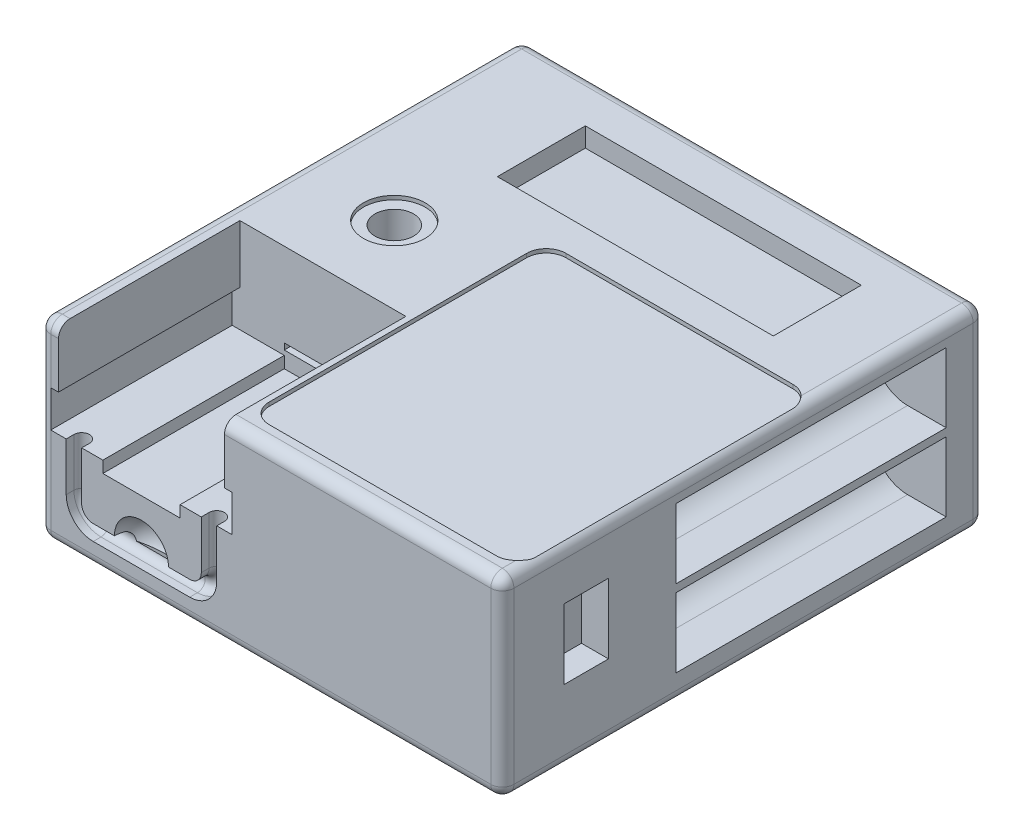
from build123d import *

# Parameters (mm, degrees)
SKETCH1_W           = 120
SKETCH1_H           = 125
BOSS_EXTRUDE1_DEPTH = 70
SKETCH3_W           = 47
SKETCH3_H           = 9.5
CUT_EXTRUDE1_DEPTH  = 47
SKETCH4_W           = 43
SKETCH4_H           = 15
CUT_EXTRUDE2_DEPTH  = 47
CUT_REVOLVE1_ANGLE  = 120
SKETCH9_W           = 20
SKETCH9_H           = 47
CUT_EXTRUDE3_DEPTH  = 3
SKETCH10_W          = 20
SKETCH10_H          = 1.6
CUT_EXTRUDE4_DEPTH  = 3.5
CUT_EXTRUDE5_DEPTH  = 1
SKETCH13_W          = 71.5
SKETCH13_H          = 22.8
CUT_EXTRUDE6_DEPTH  = 5
SKETCH14_R          = 5
CUT_EXTRUDE7_DEPTH  = 10
SKETCH15_R          = 8
CUT_EXTRUDE8_DEPTH  = 1
SKETCH16_W          = 70
SKETCH16_H          = 18
CUT_EXTRUDE9_DEPTH  = 10
SKETCH17_W          = 70
SKETCH17_H          = 9
SKETCH18_W          = 70
SKETCH18_H          = 9
SKETCH19_W          = 60
SKETCH19_H          = 15
CUT_EXTRUDE10_DEPTH = 60
CUT_REVOLVE4_ANGLE  = 90
SKETCH21_W          = 120
SKETCH21_H          = 125
CUT_EXTRUDE11_DEPTH = 20
FILLET1_R           = 3
FILLET2_R           = 3
SKETCH22_W          = 11.5
SKETCH22_H          = 18.1
CUT_EXTRUDE12_DEPTH = 7


# Some blends are built 0.0001 mm under size
with BuildPart() as part:
    # Sketch1 → Boss-Extrude1 (new body)
    with BuildSketch(Plane(origin=(0, 0, 0), x_dir=(1, 0, 0), z_dir=(0, 1, 0))):
        with Locations((60, 62.5)):
            Rectangle(SKETCH1_W, SKETCH1_H)
    extrude(amount=BOSS_EXTRUDE1_DEPTH)

    # Sketch3 → Cut-Extrude1 (cut)
    with BuildSketch(Plane.XY):
        with Locations((26.5, 50.25)):
            Rectangle(SKETCH3_W, SKETCH3_H)
    extrude(amount=-CUT_EXTRUDE1_DEPTH, mode=Mode.SUBTRACT)

    # Sketch4 → Cut-Extrude2 (cut)
    with BuildSketch(Plane.XY):
        with Locations((26.5, 62.5)):
            Rectangle(SKETCH4_W, SKETCH4_H)
    extrude(amount=-CUT_EXTRUDE2_DEPTH, mode=Mode.SUBTRACT)

    # Cut-Sweep1: sweep along a path in Sketch5
    with BuildLine(Plane.XY) as cut_sweep1_path:
        Line((9, 45.5), (9, 33))
        ThreePointArc((9, 33), (10.464466094, 29.464466094), (14, 28))
        Line((14, 28), (39, 28))
        ThreePointArc((39, 28), (42.535533906, 29.464466094), (44, 33))
        Line((44, 33), (44, 45.5))
    # Sketch6 → Cut-Sweep1 (sweep, cut)
    with BuildSketch(Plane(origin=(0, 45.5, 0), x_dir=(1, 0, 0), z_dir=(0, 1, 0))):
        with BuildLine():
            Line((7, 0), (7, 2))
            ThreePointArc((7, 2), (9, 4), (11, 2))
            Line((11, 2), (11, 0))
            Line((11, 0), (7, 0))
        make_face()
    sweep(path=cut_sweep1_path.line, mode=Mode.SUBTRACT)

    # Sketch7 → Cut-Revolve1 (revolve, cut)
    with BuildSketch(Plane.XY):
        with BuildLine():
            Line((19.5, 30), (33.5, 30))
            ThreePointArc((33.5, 30), (26.5, 37), (19.5, 30))
        make_face()
    revolve(axis=Axis((19.5, 30, 0), (-1, 0, 0)), revolution_arc=CUT_REVOLVE1_ANGLE, mode=Mode.SUBTRACT)

    # Sketch9 → Cut-Extrude3 (cut)
    with BuildSketch(Plane(origin=(0, 45.5, 0), x_dir=(1, 0, 0), z_dir=(0, 1, 0))):
        with Locations((26.5, 23.5)):
            Rectangle(SKETCH9_W, SKETCH9_H)
    extrude(amount=-CUT_EXTRUDE3_DEPTH, mode=Mode.SUBTRACT)

    # Sketch10 → Cut-Extrude4 (cut)
    with BuildSketch(Plane.XY.offset(-47)):
        with Locations((26.5, 47.5)):
            Rectangle(SKETCH10_W, SKETCH10_H)
    extrude(amount=-CUT_EXTRUDE4_DEPTH, mode=Mode.SUBTRACT)

    # Sketch11 → Cut-Extrude5 (cut)
    with BuildSketch(Plane(origin=(0, 70, 0), x_dir=(1, 0, 0), z_dir=(0, 1, 0))):
        with BuildLine():
            Line((54.58, 81.89), (113.38, 81.89))
            ThreePointArc((113.38, 81.89), (116.972102448, 80.402102448), (118.46, 76.81))
            Line((118.46, 76.81), (118.46, 10.08))
            ThreePointArc((118.46, 10.08), (116.972102448, 6.487897552), (113.38, 5))
            Line((113.38, 5), (54.58, 5))
            ThreePointArc((54.58, 5), (50.987897552, 6.487897552), (49.5, 10.08))
            Line((49.5, 10.08), (49.5, 76.81))
            ThreePointArc((49.5, 76.81), (50.987897552, 80.402102448), (54.58, 81.89))
        make_face()
    extrude(amount=-CUT_EXTRUDE5_DEPTH, mode=Mode.SUBTRACT)

    # Sketch13 → Cut-Extrude6 (cut)
    with BuildSketch(Plane(origin=(0, 70, 0), x_dir=(1, 0, 0), z_dir=(0, 1, 0))):
        with Locations((64.25, 101.6)):
            Rectangle(SKETCH13_W, SKETCH13_H)
    extrude(amount=-CUT_EXTRUDE6_DEPTH, mode=Mode.SUBTRACT)

    # Sketch14 → Cut-Extrude7 (cut)
    with BuildSketch(Plane(origin=(0, 70, 0), x_dir=(1, 0, 0), z_dir=(0, 1, 0))):
        with Locations(Location((25, 67, 0), (0, 0, 270))):
            Circle(SKETCH14_R)
    extrude(amount=-CUT_EXTRUDE7_DEPTH, mode=Mode.SUBTRACT)

    # Sketch15 → Cut-Extrude8 (cut)
    with BuildSketch(Plane(origin=(0, 70, 0), x_dir=(1, 0, 0), z_dir=(0, 1, 0))):
        with Locations(Location((25, 67, 0), (0, 0, 270))):
            Circle(SKETCH15_R)
    extrude(amount=-CUT_EXTRUDE8_DEPTH, mode=Mode.SUBTRACT)

    # Sketch16 → Cut-Extrude9 (cut)
    with BuildSketch(Plane(origin=(120, 0, 0), x_dir=(0, 0, -1), z_dir=(1, 0, 0))):
        with Locations((80, 56)):
            Rectangle(SKETCH16_W, SKETCH16_H)
        with Locations((80, 36)):
            Rectangle(SKETCH16_W, SKETCH16_H)
    extrude(amount=-CUT_EXTRUDE9_DEPTH, mode=Mode.SUBTRACT)

    # Sketch17 → Cut-Revolve2 (revolve, cut)
    with BuildSketch(Plane(origin=(110, 0, 0), x_dir=(0, 0, -1), z_dir=(1, 0, 0))):
        with Locations((80, 60.5)):
            Rectangle(SKETCH17_W, SKETCH17_H)
    revolve(axis=Axis((110, 56, -45), (0, 0, -1)), mode=Mode.SUBTRACT)

    # Sketch18 → Cut-Revolve3 (revolve, cut)
    with BuildSketch(Plane(origin=(110, 0, 0), x_dir=(0, 0, -1), z_dir=(1, 0, 0))):
        with Locations((80, 40.5)):
            Rectangle(SKETCH18_W, SKETCH18_H)
    revolve(axis=Axis((110, 36, -45), (0, 0, -1)), mode=Mode.SUBTRACT)

    # Sketch19 → Cut-Extrude10 (cut)
    with BuildSketch(Plane.ZY):
        with Locations((-85, 37.5)):
            Rectangle(SKETCH19_W, SKETCH19_H)
    extrude(amount=-CUT_EXTRUDE10_DEPTH, mode=Mode.SUBTRACT)

    # Sketch20 → Cut-Revolve4 (revolve, cut)
    with BuildSketch(Plane.ZY):
        with BuildLine():
            Line((-95, 45), (-75, 45))
            ThreePointArc((-75, 45), (-85, 55), (-95, 45))
        make_face()
    revolve(axis=Axis((0, 45, -95), (0, 0, -1)), revolution_arc=CUT_REVOLVE4_ANGLE, mode=Mode.SUBTRACT)

    # Sketch21 → Cut-Extrude11 (cut)
    with BuildSketch(Plane.XZ):
        with Locations((60, -62.5)):
            Rectangle(SKETCH21_W, SKETCH21_H)
    extrude(amount=-CUT_EXTRUDE11_DEPTH, mode=Mode.SUBTRACT)

    # Fillet1
    fillet1_edges = [part.edges().sort_by_distance(p)[0] for p in [
        (60, 20, 0),
        (120, 20, -62.5),
        (60, 20, -125),
        (0, 20, -62.5),
        (0, 45, -125),
        (120, 45, -125),
        (120, 45, 0),
        (0, 45, 0),
    ]]
    fillet(fillet1_edges, radius=FILLET1_R - 0.0001)  # a hair under: the kernel refuses the full size

    # Fillet2
    # the kernel refuses this fillet: 3 mm, written as the material it takes off along each edge
    with BuildSketch(Plane(origin=(40.500249996, 70, 0), x_dir=(0, -0.9999999994444074, 3.3334444463032727e-05), z_dir=(1, 0, 0))) as fillet2_piece_1:
        with BuildLine():
            CenterArc((2.999799998, 2.999999998), FILLET2_R, 180.001909923, 90)
            Line((-0.0002, 2.999899995), (-0.0602, 2.999897995))
            ThreePointArc((-0.0602, 2.999897995), (-0.06005, 1.499947999), (-0.06, -2e-06))
            Line((-0.06, -2e-06), (2e-06, -0.06))
            ThreePointArc((2e-06, -0.06), (1.499951999, -0.05995), (2.999902002, -0.06))
            Line((2.999902002, -0.06), (2.999900002, 0))
        make_face()
    extrude(amount=76.499850004, mode=Mode.SUBTRACT)
    with BuildSketch(Plane(origin=(117.0001, 70, -2.9999), x_dir=(0, 0, 1), z_dir=(-1, 0, 0))) as fillet2_piece_2:
        with BuildLine():
            CenterArc((0, -2.9999), FILLET2_R, 0, 90)
            Line((3, -2.9999), (3.06, -2.9999))
            ThreePointArc((3.06, -2.9999), (3.0599, -1.49995), (3.0599, 0))
            Line((3.0599, 0), (2.9999, 0.06))
            ThreePointArc((2.9999, 0.06), (1.49995, 0.06), (0, 0.0601))
            Line((0, 0.0601), (0, 0.0001))
        make_face()
    revolve(axis=Axis((117.0001, 70, -2.9999), (0, 1, 0)), revolution_arc=90, mode=Mode.SUBTRACT)
    with BuildSketch(Plane(origin=(120, 70, -2.9999), x_dir=(-0.9999999994444074, 3.333444446406897e-05, 0), z_dir=(0, 0, -1)), Plane(origin=(0, 70, -122.0001), x_dir=(0.9999999994444074, 3.333444446406897e-05, 0), z_dir=(0, 0, 1))) as fillet2_piece_3:
        with BuildLine():
            CenterArc((2.999799998, -2.999999998), FILLET2_R, 89.998090077, 90)
            Line((-0.0002, -2.999899995), (-0.0602, -2.999897995))
            ThreePointArc((-0.0602, -2.999897995), (-0.06005, -1.499947999), (-0.06, 2e-06))
            Line((-0.06, 2e-06), (2e-06, 0.06))
            ThreePointArc((2e-06, 0.06), (1.499951999, 0.05995), (2.999902002, 0.06))
            Line((2.999902002, 0.06), (2.999900002, 0))
        make_face()
    extrude(amount=119.0002, mode=Mode.SUBTRACT)
    with BuildSketch(Plane(origin=(117.0001, 70, -122.0001), x_dir=(1, 0, 0), z_dir=(0, 0, 1))) as fillet2_piece_4:
        with BuildLine():
            CenterArc((0, -2.9999), FILLET2_R, 0, 90)
            Line((3, -2.9999), (3.06, -2.9999))
            ThreePointArc((3.06, -2.9999), (3.0599, -1.49995), (3.0599, 0))
            Line((3.0599, 0), (2.9999, 0.06))
            ThreePointArc((2.9999, 0.06), (1.49995, 0.06), (0, 0.0601))
            Line((0, 0.0601), (0, 0.0001))
        make_face()
    revolve(axis=Axis((117.0001, 70, -122.0001), (0, 1, 0)), revolution_arc=90, mode=Mode.SUBTRACT)
    with BuildSketch(Plane(origin=(117.0001, 70, -125), x_dir=(0, 3.333444446406897e-05, 0.9999999994444074), z_dir=(-1, 0, 0))) as fillet2_piece_5:
        with BuildLine():
            CenterArc((2.999799998, -2.999999998), FILLET2_R, 89.998090077, 90)
            Line((-0.0002, -2.999899995), (-0.0602, -2.999897995))
            ThreePointArc((-0.0602, -2.999897995), (-0.06005, -1.499947999), (-0.06, 2e-06))
            Line((-0.06, 2e-06), (2e-06, 0.06))
            ThreePointArc((2e-06, 0.06), (1.499951999, 0.05995), (2.999902002, 0.06))
            Line((2.999902002, 0.06), (2.999900002, 0))
        make_face()
    extrude(amount=114.0002, mode=Mode.SUBTRACT)
    with BuildSketch(Plane(origin=(2.9999, 70, -122.0001), x_dir=(-1, 0, 0), z_dir=(0, 0, 1))) as fillet2_piece_6:
        with BuildLine():
            CenterArc((0, 2.9999), FILLET2_R, 270, 90)
            Line((3, 2.9999), (3.06, 2.9999))
            ThreePointArc((3.06, 2.9999), (3.0599, 1.49995), (3.0599, 0))
            Line((3.0599, 0), (2.9999, -0.06))
            ThreePointArc((2.9999, -0.06), (1.49995, -0.06), (0, -0.0601))
            Line((0, -0.0601), (0, -0.0001))
        make_face()
    revolve(axis=Axis((2.9999, 70, -122.0001), (0, -1, 0)), revolution_arc=90, mode=Mode.SUBTRACT)
    with BuildSketch(Plane(origin=(2.9999, 70, 0), x_dir=(0, -0.9999999994444074, 3.3334444463032727e-05), z_dir=(1, 0, 0))) as fillet2_piece_7:
        with BuildLine():
            CenterArc((2.999799998, 2.999999998), FILLET2_R, 180.001909923, 90)
            Line((-0.0002, 2.999899995), (-0.0602, 2.999897995))
            ThreePointArc((-0.0602, 2.999897995), (-0.06005, 1.499947999), (-0.06, -2e-06))
            Line((-0.06, -2e-06), (2e-06, -0.06))
            ThreePointArc((2e-06, -0.06), (1.499951999, -0.05995), (2.999902002, -0.06))
            Line((2.999902002, -0.06), (2.999900002, 0))
        make_face()
    extrude(amount=9.499850004, mode=Mode.SUBTRACT)
    with BuildSketch(Plane(origin=(2.9999, 70, -2.9999), x_dir=(0, 0, 1), z_dir=(1, 0, 0))) as fillet2_piece_8:
        with BuildLine():
            CenterArc((0, 2.9999), FILLET2_R, 270, 90)
            Line((3, 2.9999), (3.06, 2.9999))
            ThreePointArc((3.06, 2.9999), (3.0599, 1.49995), (3.0599, 0))
            Line((3.0599, 0), (2.9999, -0.06))
            ThreePointArc((2.9999, -0.06), (1.49995, -0.06), (0, -0.0601))
            Line((0, -0.0601), (0, -0.0001))
        make_face()
    revolve(axis=Axis((2.9999, 70, -2.9999), (0, -1, 0)), revolution_arc=90, mode=Mode.SUBTRACT)

    # Sketch22 → Cut-Extrude12 (cut)
    with BuildSketch(Plane(origin=(120, 0, 0), x_dir=(0, 0, -1), z_dir=(1, 0, 0))):
        with Locations((21.75, 47.95)):
            Rectangle(SKETCH22_W, SKETCH22_H)
    extrude(amount=-CUT_EXTRUDE12_DEPTH, mode=Mode.SUBTRACT)


solid = part.part
